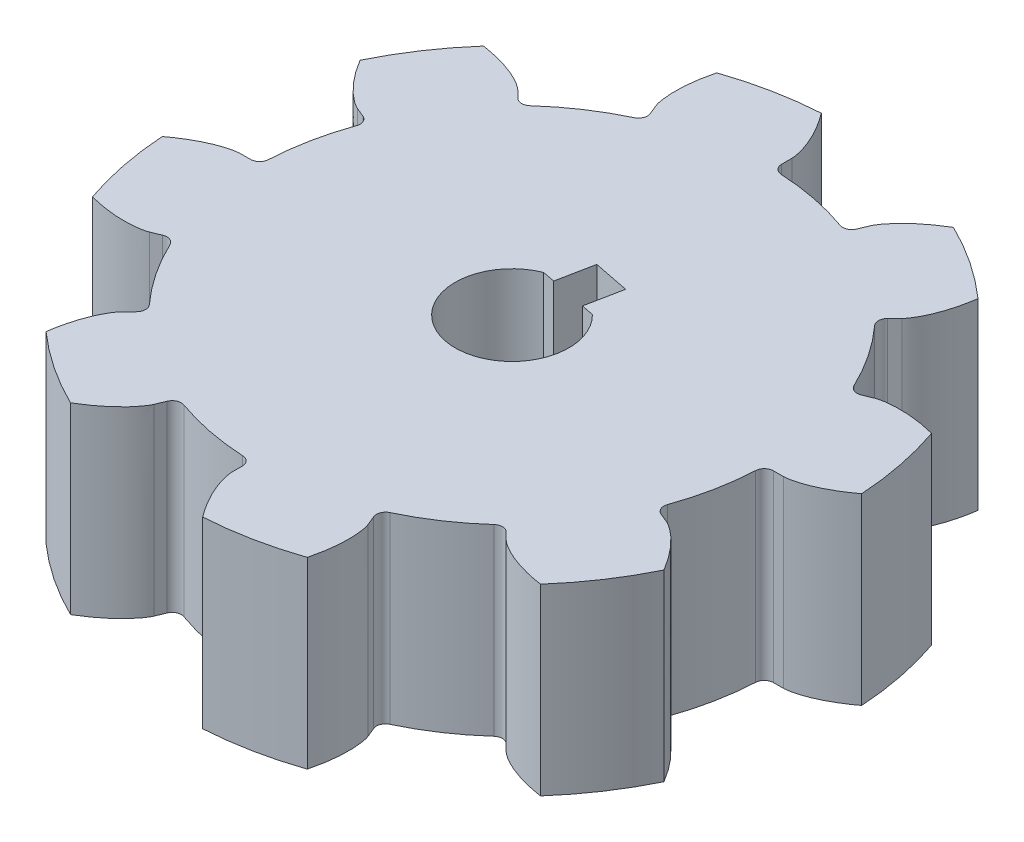
from build123d import *

# Parameters (mm, degrees)
SKETCH_4_R                       = 14
EXTRUDE_1_DEPTH                  = 10
EXTRUDE_2_DEPTH                  = 10
FILLET_1_R                       = 0.5
PATTERN_CIRCULAR_1_COUNT         = 8
FILLET_1_OF_PATTERN_CIRCULAR_1_R = 0.5
CUT_EXTRUDE_1_DEPTH              = 28.30524858


with BuildPart() as part:
    # ｽｹｯﾁ4 → ﾎﾞｽ - 押し出し1 (new body)
    with BuildSketch(Plane(origin=(0, 0, 0), x_dir=(1, 0, 0), z_dir=(0, 1, 0))):
        Circle(SKETCH_4_R)
    extrude(amount=EXTRUDE_1_DEPTH)

    # ｽｹｯﾁ3 → ﾎﾞｽ - 押し出し2 (add)
    with BuildSketch(Plane(origin=(0, 0, 0), x_dir=(1, 0, 0), z_dir=(0, 1, 0))):
        with BuildLine():
            Line((0.224080336, 15.033412012), (0.224080336, 13.9982066))
            ThreePointArc((0.224080336, 13.9982066), (-2.731264508, 13.730993926), (-5.563904985, 12.846904737))
            Line((-5.563904985, 12.846904737), (-5.960060945, 13.80330983))
            add(Edge.make_bspline(
                [(-5.858426114, 17.019954273), (-5.920939237, 16.775820636), (-6.005177259, 16.385669184), (-6.081389407, 15.859669081), (-6.117456435, 15.463573167), (-6.130866377, 15.108674888), (-6.126107546, 14.796141282), (-6.107718221, 14.526781883), (-6.080279115, 14.301036558), (-6.048330179, 14.119000945), (-6.01650055, 13.980359087), (-5.987708331, 13.879742422), (-5.969195203, 13.825538164), (-5.960060945, 13.80330983)],
                knots=[0, 0, 0, 0, 0.232146242, 0.367277189, 0.48933989, 0.598334347, 0.694260559, 0.777118527, 0.846908252, 0.903629737, 0.947282983, 0.977868, 1, 1, 1, 1], degree=3))
            ThreePointArc((-5.858426114, 17.019954273), (-3.511625796, 17.654135047), (-1.10077454, 17.966310011))
            add(Edge.make_bspline(
                [(-1.10077454, 17.966310011), (-0.949594047, 17.764682676), (-0.722463767, 17.436466231), (-0.450761398, 16.979670628), (-0.265860465, 16.627527975), (-0.117657603, 16.304776481), (-0.002452756, 16.014211953), (0.083637102, 15.758319028), (0.14467567, 15.539257051), (0.184820715, 15.358851746), (0.208469915, 15.218582699), (0.220373703, 15.114606716), (0.224012874, 15.057443845), (0.224080336, 15.033412012)],
                knots=[0, 0, 0, 0, 0.232146242, 0.367277189, 0.48933989, 0.598334347, 0.694260559, 0.777118527, 0.846908252, 0.903629737, 0.947282983, 0.977868, 1, 1, 1, 1], degree=3))
        make_face()
    extrude_2 = extrude(amount=EXTRUDE_2_DEPTH)

    # ﾌｨﾚｯﾄ1
    fillet_1_edges = [part.edges().sort_by_distance(p)[0] for p in [
        (-5.563904985, 5, -12.846904737),
        (0.224080336, 5, -13.9982066),
    ]]
    fillet(fillet_1_edges, radius=FILLET_1_R)

    # 円形ﾊﾟﾀｰﾝ1: ﾎﾞｽ - 押し出し2 ×8 about axis
    pattern_circular_1_axis = Axis((0, 10, 0), (0, 1, 0))
    for i in range(1, PATTERN_CIRCULAR_1_COUNT):
        add(extrude_2.rotate(pattern_circular_1_axis, i * 360 / PATTERN_CIRCULAR_1_COUNT))

    # ﾌｨﾚｯﾄ1 of 円形ﾊﾟﾀｰﾝ1
    fillet_1_of_pattern_circular_1_edges = [part.edges().sort_by_distance(p)[0] for p in [
        (-13.018408401, 5, -5.149858512),
        (-9.739778086, 5, -10.056675536),
        (-12.846904737, 5, 5.563904985),
        (-13.9982066, 5, -0.224080336),
        (-5.149858512, 5, 13.018408401),
        (-10.056675536, 5, 9.739778086),
        (5.563904985, 5, 12.846904737),
        (-0.224080336, 5, 13.9982066),
        (13.018408401, 5, 5.149858512),
        (9.739778086, 5, 10.056675536),
        (12.846904737, 5, -5.563904985),
        (13.9982066, 5, 0.224080336),
        (5.149858512, 5, -13.018408401),
        (10.056675536, 5, -9.739778086),
    ]]
    fillet(fillet_1_of_pattern_circular_1_edges, radius=FILLET_1_OF_PATTERN_CIRCULAR_1_R)

    # ｽｹｯﾁ5 → ｶｯﾄ - 押し出し1 (cut, through all)
    with BuildSketch(Plane(origin=(0, 10, 0), x_dir=(1, 0, 0), z_dir=(0, 1, 0))):
        with BuildLine():
            Line((-1.148521284, 2.879392099), (-0.473550443, 2.745132051))
            Line((-0.473550443, 2.745132051), (-0.083369799, 4.706702612))
            Line((-0.083369799, 4.706702612), (1.878200762, 4.316521968))
            Line((1.878200762, 4.316521968), (1.488020118, 2.354951407))
            Line((1.488020118, 2.354951407), (2.162990959, 2.220691359))
            ThreePointArc((2.162990959, 2.220691359), (-0.604779998, -3.040434369), (-1.148521284, 2.879392099))
        make_face()
    extrude(amount=-CUT_EXTRUDE_1_DEPTH, mode=Mode.SUBTRACT)


solid = part.part
